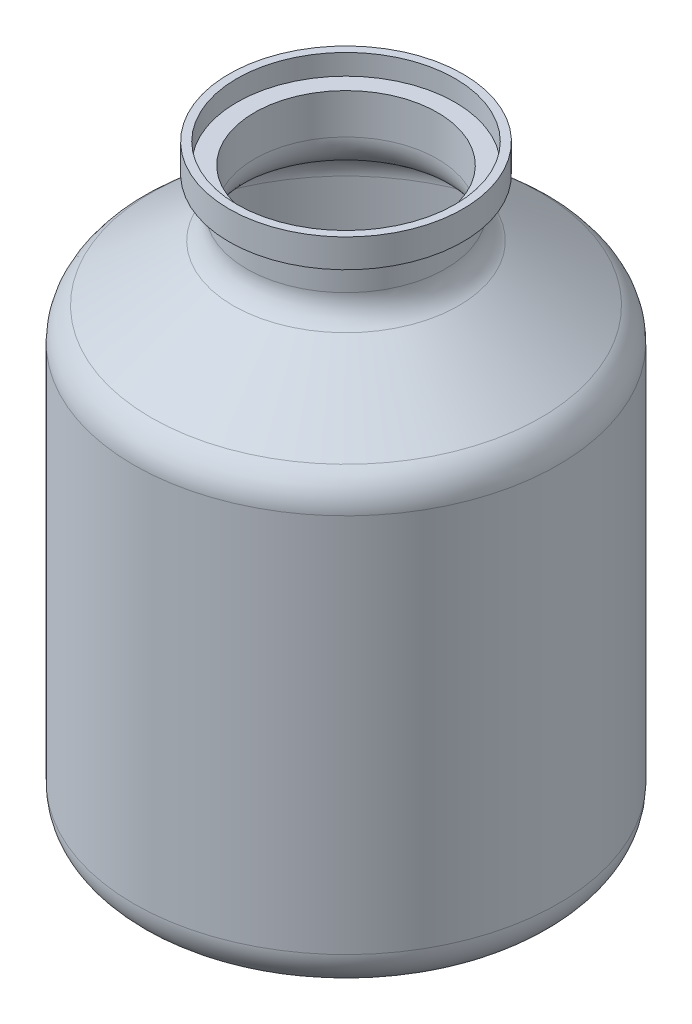
from build123d import *


# Read off the part's stored shape, not the designer's step: Shell1
with BuildPart() as part:
    # Sketch1 → Revolve1 (revolve)
    with BuildSketch(Plane.XY, mode=Mode.PRIVATE) as revolve1_sk:
        with BuildLine():
            Line((0, 0), (55.850610629, 0))
            ThreePointArc((55.850610629, 0), (64.83086675, 3.719743879), (68.550610629, 12.7))
            Line((68.550610629, 12.7), (68.550610629, 135.537090781))
            ThreePointArc((68.550610629, 135.537090781), (67.07437947, 141.479902659), (62.988876295, 146.041145392))
            Line((62.988876295, 146.041145392), (36.426242146, 164.092378593))
            ThreePointArc((36.426242146, 164.092378593), (33.255344861, 167.632513451), (32.109591896, 172.244930881))
            Line((32.109591896, 172.244930881), (32.109591896, 182.693006016))
            Line((32.109591896, 182.693006016), (37.812538782, 182.693006016))
            Line((37.812538782, 182.693006016), (37.812538782, 191.889991998))
            Line((37.812538782, 191.889991998), (0, 191.889991998))
            Line((0, 191.889991998), (0, 0))
        make_face()
    revolve(revolve1_sk.sketch.rotate(Axis((0, 191.889991998, 0), (0, -1, 0)), 90), axis=Axis((0, 191.889991998, 0), (0, -1, 0)))

    # Shell1 outline → Shell1 (revolve, cut)
    with BuildSketch(Plane.XY):
        with BuildLine():
            Line((55.850610629, 0), (55.850610629, 2.54))
            ThreePointArc((55.850610629, 2.54), (63.034815526, 5.515795103), (66.010610629, 12.7))
            Line((66.010610629, 12.7), (66.010610629, 135.537090781))
            ThreePointArc((66.010610629, 135.537090781), (64.829625702, 140.291340284), (61.561223162, 143.94033447))
            Line((61.561223162, 143.94033447), (34.998589013, 161.991567671))
            ThreePointArc((34.998589013, 161.991567671), (31.010591093, 166.443951075), (29.569591896, 172.244930881))
            Line((29.569591896, 172.244930881), (29.569591896, 185.233006016))
            Line((29.569591896, 185.233006016), (35.272538782, 185.233006016))
            Line((35.272538782, 185.233006016), (35.272538782, 191.889991998))
            Line((35.272538782, 191.889991998), (0, 191.889991998))
            Line((0, 191.889991998), (0, 0))
            Line((0, 0), (55.850610629, 0))
        make_face()
    revolve(axis=Axis((0, 0, 0), (0, 1, 0)), mode=Mode.SUBTRACT)


solid = part.part
